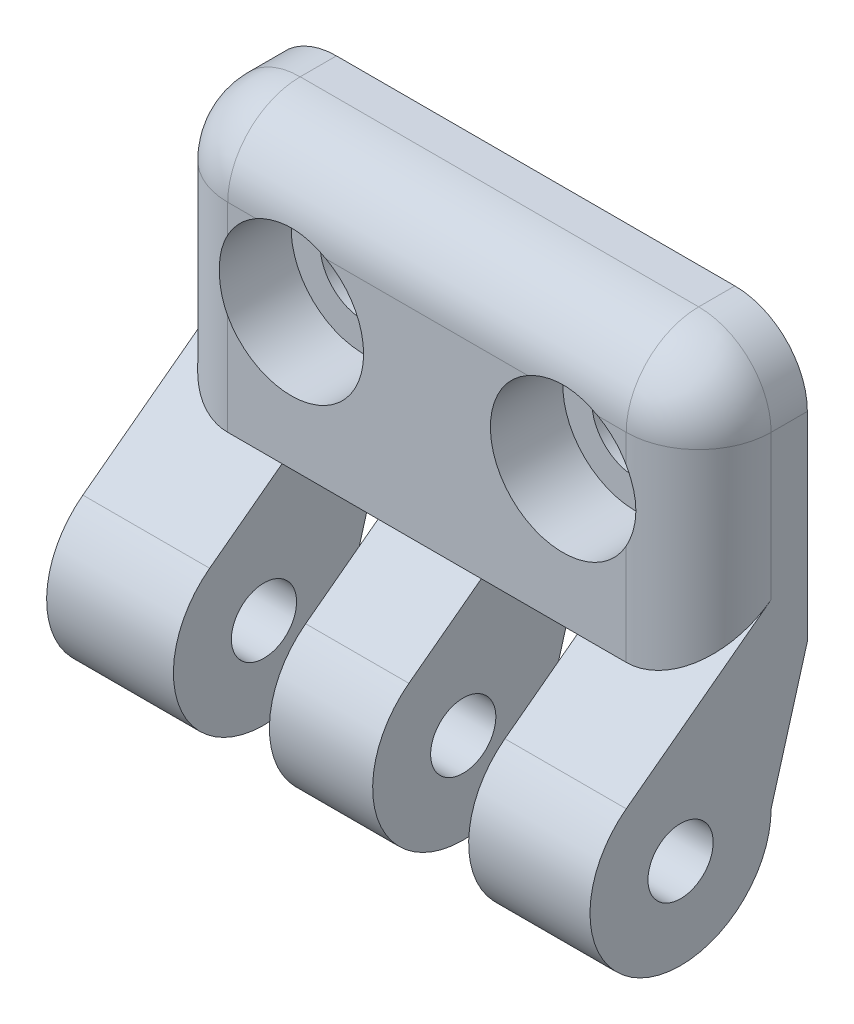
from build123d import *

# Parameters (mm, degrees)
SKETCH2_W                      = 30
SKETCH2_H                      = 15
BOSS_EXTRUDE1_DEPTH            = 6
CBORE_FOR_M4_SHCS1_D           = 4.8
CBORE_FOR_M4_SHCS1_CBORE_D     = 8
CBORE_FOR_M4_SHCS1_CBORE_DEPTH = 4
BOSS_EXTRUDE2_DEPTH            = 30
CUT_EXTRUDE1_START             = -15
SKETCH6_W                      = 5.3
SKETCH6_H                      = 20.435085946
SKETCH6_H_2                    = 17.047451378
CUT_EXTRUDE1_DEPTH             = 28.107006543
FILLET1_R                      = 4
CBORE_FOR_M3_SHCS1_D           = 3.6
CBORE_FOR_M3_SHCS1_CBORE_D     = 6.5
CBORE_FOR_M3_SHCS1_CBORE_DEPTH = 3


with BuildPart() as part:
    # Sketch2 → Boss-Extrude1 (new body)
    with BuildSketch(Plane.XY):
        with Locations((15, 7.5)):
            Rectangle(SKETCH2_W, SKETCH2_H)
    extrude(amount=BOSS_EXTRUDE1_DEPTH)

    # CBORE for M4 SHCS1 (through all)
    with Locations(Plane.XY.offset(6)):
        with Locations((7.5, 7.5), (22.5, 7.5)):
            CounterBoreHole(CBORE_FOR_M4_SHCS1_D / 2, CBORE_FOR_M4_SHCS1_CBORE_D / 2, CBORE_FOR_M4_SHCS1_CBORE_DEPTH)

    # Sketch5 → Boss-Extrude2 (add)
    with BuildSketch(Plane(origin=(30, 0, 0), x_dir=(0, 0, -1), z_dir=(1, 0, 0))):
        with BuildLine():
            Line((0, 0), (-2, -7))
            ThreePointArc((-2, -7), (-9.236067977, -11.472135955), (-10, -3))
            Line((-10, -3), (-6, 0))
            Line((-6, 0), (0, 0))
        make_face()
    extrude(amount=-BOSS_EXTRUDE2_DEPTH)

    # Sketch6 → Cut-Extrude1 (cut, through all)
    with BuildSketch(Plane(origin=(0, 15, 0), x_dir=(1, 0, 0), z_dir=(0, 1, 0)).offset(CUT_EXTRUDE1_START)):
        with Locations((20.65, -5.918041099)):
            Rectangle(SKETCH6_W, SKETCH6_H)
        with Locations((9.65, -5.207730625)):
            Rectangle(SKETCH6_W, SKETCH6_H_2)
    extrude(amount=-CUT_EXTRUDE1_DEPTH, mode=Mode.SUBTRACT)

    # Fillet1
    # the kernel refuses this fillet: 4 mm, written as the material it takes off along each edge
    with BuildSketch(Plane(origin=(26, 11, 2), x_dir=(0, 0, 1), z_dir=(0, 1, 0))) as fillet1_piece_1_section:
        Polygon((0, 0), (FILLET1_R, 0), (FILLET1_R, FILLET1_R), (0, FILLET1_R), align=None)
    fillet1_piece_1 = extrude(amount=FILLET1_R, mode=Mode.PRIVATE)
    fillet1_piece_1 = fillet1_piece_1 - Plane(origin=(26, 11, 2), x_dir=(-0.7071067811865475, 0, -0.7071067811865475), z_dir=(0, 1, 0)) * Sphere(FILLET1_R, mode=Mode.PRIVATE)
    add(fillet1_piece_1, mode=Mode.SUBTRACT)
    with BuildSketch(Plane(origin=(4, 11, 2), x_dir=(0, 1, 0), z_dir=(-1, 0, 0))) as fillet1_piece_2_section:
        Polygon((0, 0), (FILLET1_R, 0), (FILLET1_R, -FILLET1_R), (0, -FILLET1_R), align=None)
    fillet1_piece_2 = extrude(amount=FILLET1_R, mode=Mode.PRIVATE)
    fillet1_piece_2 = fillet1_piece_2 - Plane(origin=(4, 11, 2), x_dir=(0, -0.7071067811865475, -0.7071067811865475), z_dir=(-1, 0, 0)) * Sphere(FILLET1_R, mode=Mode.PRIVATE)
    add(fillet1_piece_2, mode=Mode.SUBTRACT)
    with BuildSketch(Plane(origin=(30, -10, 6), x_dir=(-1, 0, 0), z_dir=(0, 1, 0))) as fillet1_piece_3_section:
        with BuildLine():
            CenterArc((FILLET1_R, -FILLET1_R), FILLET1_R, 90, 90)
            Line((0, -FILLET1_R), (0, 0))
            Line((0, 0), (FILLET1_R, 0))
        make_face()
    fillet1_piece_3 = extrude(amount=21, mode=Mode.PRIVATE)
    fillet1_piece_3 = split(fillet1_piece_3, bisect_by=Plane(origin=(29.062495656, 2.503698405, 2.66173546), z_dir=(0, 0.8, 0.6)), keep=Keep.TOP, mode=Mode.PRIVATE)
    add(fillet1_piece_3, mode=Mode.SUBTRACT)
    with BuildSketch(Plane(origin=(26, 15, 6), x_dir=(0, 0, -1), z_dir=(-1, 0, 0))) as fillet1_piece_4:
        with BuildLine():
            CenterArc((FILLET1_R, FILLET1_R), FILLET1_R, 180, 90)
            Line((0, FILLET1_R), (0, 0))
            Line((0, 0), (FILLET1_R, 0))
        make_face()
    extrude(amount=22, mode=Mode.SUBTRACT)
    with BuildSketch(Plane(origin=(0, 11, 6), x_dir=(0, 0, -1), z_dir=(0, -1, 0))) as fillet1_piece_5_section:
        with BuildLine():
            CenterArc((FILLET1_R, FILLET1_R), FILLET1_R, 180, 90)
            Line((0, FILLET1_R), (0, 0))
            Line((0, 0), (FILLET1_R, 0))
        make_face()
    fillet1_piece_5 = extrude(amount=21, mode=Mode.PRIVATE)
    fillet1_piece_5 = split(fillet1_piece_5, bisect_by=Plane(origin=(0.937504344, 2.503698405, 2.66173546), z_dir=(0, 0.8, 0.6)), keep=Keep.TOP, mode=Mode.PRIVATE)
    add(fillet1_piece_5, mode=Mode.SUBTRACT)
    with BuildSketch(Plane(origin=(0, 15, -10), x_dir=(0, -1, 0), z_dir=(0, 0, 1)), Plane(origin=(30, 15, -10), x_dir=(-1, 0, 0), z_dir=(0, 0, 1))) as fillet1_piece_6:
        with BuildLine():
            CenterArc((FILLET1_R, FILLET1_R), FILLET1_R, 180, 90)
            Line((0, FILLET1_R), (0, 0))
            Line((0, 0), (FILLET1_R, 0))
        make_face()
    extrude(amount=12, mode=Mode.SUBTRACT)

    # CBORE for M3 SHCS1 (through all)
    with Locations(Plane.ZY):
        with Locations((7, -7)):
            CounterBoreHole(CBORE_FOR_M3_SHCS1_D / 2, CBORE_FOR_M3_SHCS1_CBORE_D / 2, CBORE_FOR_M3_SHCS1_CBORE_DEPTH)


solid = part.part
